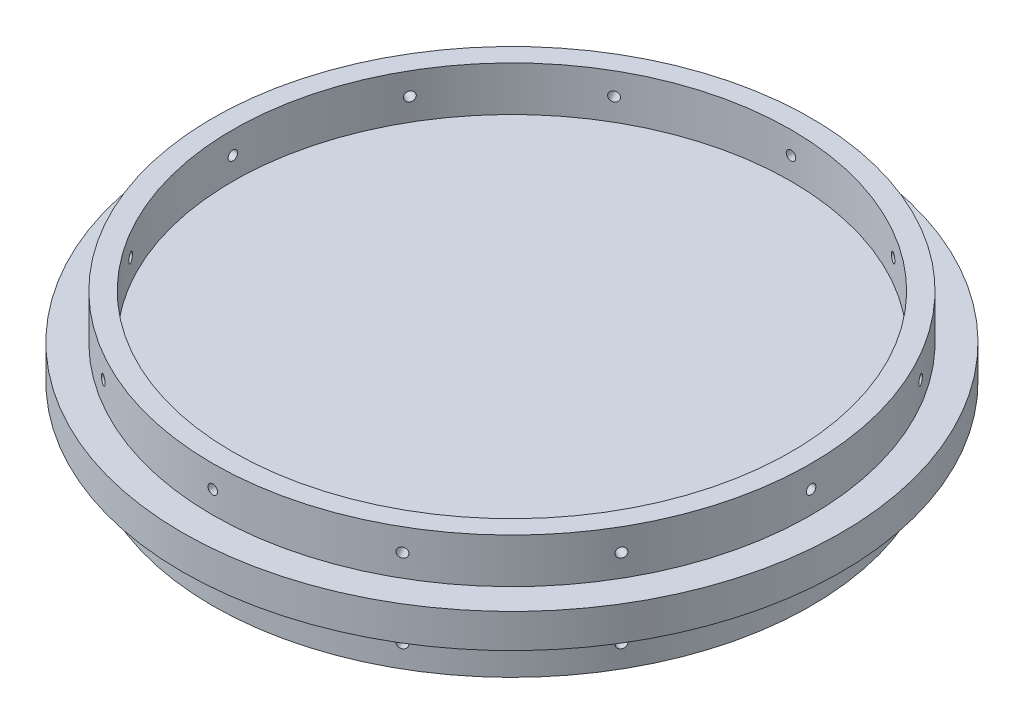
from build123d import *

# Parameters (mm, degrees)
SKETCH1_R                = 93.726
BOSS_EXTRUDE1_DEPTH      = 4.826
SKETCH4_R                = 85.09
SKETCH4_R_2              = 79.375
BOSS_EXTRUDE2_DEPTH      = 12.7
SKETCH5_R                = 1.35255
CUT_EXTRUDE2_DEPTH       = 12.7
CIRPATTERN1_COUNT        = 12
MIRROR2_COPY_1_SKETCH_R  = 1.35255
MIRROR2_COPY_1_DEPTH     = 12.7
MIRROR2_COPY_2_SKETCH_R  = 1.35255
MIRROR2_COPY_2_DEPTH     = 12.7
MIRROR2_COPY_3_SKETCH_R  = 1.35255
MIRROR2_COPY_3_DEPTH     = 12.7
MIRROR2_COPY_4_SKETCH_R  = 1.35255
MIRROR2_COPY_4_DEPTH     = 12.7
MIRROR2_COPY_5_SKETCH_R  = 1.35255
MIRROR2_COPY_5_DEPTH     = 12.7
MIRROR2_COPY_6_SKETCH_R  = 1.35255
MIRROR2_COPY_6_DEPTH     = 12.7
MIRROR2_COPY_7_SKETCH_R  = 1.35255
MIRROR2_COPY_7_DEPTH     = 12.7
MIRROR2_COPY_8_SKETCH_R  = 1.35255
MIRROR2_COPY_8_DEPTH     = 12.7
MIRROR2_COPY_9_SKETCH_R  = 1.35255
MIRROR2_COPY_9_DEPTH     = 12.7
MIRROR2_COPY_10_SKETCH_R = 1.35255
MIRROR2_COPY_10_DEPTH    = 12.7
MIRROR2_COPY_11_SKETCH_R = 1.35255
MIRROR2_COPY_11_DEPTH    = 12.7


with BuildPart() as part:
    # Sketch1 → Boss-Extrude1 (new, symmetric)
    with BuildSketch(Plane(origin=(0, 0, 0), x_dir=(1, 0, 0), z_dir=(0, 1, 0))):
        Circle(SKETCH1_R)
    extrude(amount=BOSS_EXTRUDE1_DEPTH, both=True)

    # Sketch2 → Cut-Revolve1 (revolve, cut)
    with BuildSketch(Plane.XY):
        with BuildLine():
            Line((0, -4.826), (-25.4, -4.826))
            add(Edge.make_bspline(
                [(0, 1.27), (-5.119708802, 1.512901127), (-13.685198777, -0.496611023), (-22.158477128, -2.939757283), (-25.4, -4.826)],
                knots=[0, 0, 0, 0, 0.575798634, 1, 1, 1, 1], degree=3))
            Line((0, 1.27), (0, -4.826))
        make_face()
    revolve(axis=Axis((0, -18.327530441, 0), (0, 1, 0)), mode=Mode.SUBTRACT)

    # Sketch4 → Boss-Extrude2 (add)
    with BuildSketch(Plane(origin=(0, 4.826, 0), x_dir=(1, 0, 0), z_dir=(0, 1, 0))):
        Circle(SKETCH4_R)
        Circle(SKETCH4_R_2, mode=Mode.SUBTRACT)
    boss_extrude2 = extrude(amount=BOSS_EXTRUDE2_DEPTH)

    # Sketch5 → Cut-Extrude2 (cut)
    with BuildSketch(Plane(origin=(0, 0, -85.09), x_dir=(-1, 0, 0), z_dir=(0, 0, -1))):
        with Locations((0, 11.176)):
            Circle(SKETCH5_R)
    cut_extrude2 = extrude(amount=-CUT_EXTRUDE2_DEPTH, mode=Mode.SUBTRACT)

    # CirPattern1: Cut-Extrude2 ×12 about axis
    cirpattern1_axis = Axis((0, 17.526, 0), (0, -1, 0))
    for i in range(1, CIRPATTERN1_COUNT):
        add(cut_extrude2.rotate(cirpattern1_axis, i * 360 / CIRPATTERN1_COUNT), mode=Mode.SUBTRACT)

    # Mirror2: Boss-Extrude2, Cut-Extrude2 across plane
    add(boss_extrude2.mirror(Plane.ZX))
    add(cut_extrude2.mirror(Plane.ZX), mode=Mode.SUBTRACT)

    # Mirror2 copy 1 sketch → Mirror2 copy 1 (cut)
    with BuildSketch(Plane(origin=(42.545, 0, -73.690101608), x_dir=(-0.8660254037844387, 0, -0.49999999999999994), z_dir=(0.49999999999999994, 0, -0.8660254037844387))):
        with Locations((0, -11.176)):
            Circle(MIRROR2_COPY_1_SKETCH_R)
    extrude(amount=-MIRROR2_COPY_1_DEPTH, mode=Mode.SUBTRACT)

    # Mirror2 copy 2 sketch → Mirror2 copy 2 (cut)
    with BuildSketch(Plane(origin=(73.690101608, 0, -42.545), x_dir=(-0.5000000000000001, 0, -0.8660254037844386), z_dir=(0.8660254037844386, 0, -0.5000000000000001))):
        with Locations((0, -11.176)):
            Circle(MIRROR2_COPY_2_SKETCH_R)
    extrude(amount=-MIRROR2_COPY_2_DEPTH, mode=Mode.SUBTRACT)

    # Mirror2 copy 3 sketch → Mirror2 copy 3 (cut)
    with BuildSketch(Plane(origin=(85.09, 0, 0), x_dir=(0, 0, -1), z_dir=(1, 0, 0))):
        with Locations((0, -11.176)):
            Circle(MIRROR2_COPY_3_SKETCH_R)
    extrude(amount=-MIRROR2_COPY_3_DEPTH, mode=Mode.SUBTRACT)

    # Mirror2 copy 4 sketch → Mirror2 copy 4 (cut)
    with BuildSketch(Plane(origin=(73.690101608, 0, 42.545), x_dir=(0.4999999999999998, 0, -0.8660254037844387), z_dir=(0.8660254037844387, 0, 0.4999999999999998))):
        with Locations((0, -11.176)):
            Circle(MIRROR2_COPY_4_SKETCH_R)
    extrude(amount=-MIRROR2_COPY_4_DEPTH, mode=Mode.SUBTRACT)

    # Mirror2 copy 5 sketch → Mirror2 copy 5 (cut)
    with BuildSketch(Plane(origin=(42.545, 0, 73.690101608), x_dir=(0.8660254037844387, 0, -0.49999999999999994), z_dir=(0.49999999999999994, 0, 0.8660254037844387))):
        with Locations((0, -11.176)):
            Circle(MIRROR2_COPY_5_SKETCH_R)
    extrude(amount=-MIRROR2_COPY_5_DEPTH, mode=Mode.SUBTRACT)

    # Mirror2 copy 6 sketch → Mirror2 copy 6 (cut)
    with BuildSketch(Plane.XY.offset(85.09)):
        with Locations((0, -11.176)):
            Circle(MIRROR2_COPY_6_SKETCH_R)
    extrude(amount=-MIRROR2_COPY_6_DEPTH, mode=Mode.SUBTRACT)

    # Mirror2 copy 7 sketch → Mirror2 copy 7 (cut)
    with BuildSketch(Plane(origin=(-42.545, 0, 73.690101608), x_dir=(0.8660254037844386, 0, 0.5000000000000001), z_dir=(-0.5000000000000001, 0, 0.8660254037844386))):
        with Locations((0, -11.176)):
            Circle(MIRROR2_COPY_7_SKETCH_R)
    extrude(amount=-MIRROR2_COPY_7_DEPTH, mode=Mode.SUBTRACT)

    # Mirror2 copy 8 sketch → Mirror2 copy 8 (cut)
    with BuildSketch(Plane(origin=(-73.690101608, 0, 42.545), x_dir=(0.5000000000000004, 0, 0.8660254037844384), z_dir=(-0.8660254037844384, 0, 0.5000000000000004))):
        with Locations((0, -11.176)):
            Circle(MIRROR2_COPY_8_SKETCH_R)
    extrude(amount=-MIRROR2_COPY_8_DEPTH, mode=Mode.SUBTRACT)

    # Mirror2 copy 9 sketch → Mirror2 copy 9 (cut)
    with BuildSketch(Plane.ZY.offset(85.09)):
        with Locations((0, -11.176)):
            Circle(MIRROR2_COPY_9_SKETCH_R)
    extrude(amount=-MIRROR2_COPY_9_DEPTH, mode=Mode.SUBTRACT)

    # Mirror2 copy 10 sketch → Mirror2 copy 10 (cut)
    with BuildSketch(Plane(origin=(-73.690101608, 0, -42.545), x_dir=(-0.5000000000000001, 0, 0.8660254037844386), z_dir=(-0.8660254037844386, 0, -0.5000000000000001))):
        with Locations((0, -11.176)):
            Circle(MIRROR2_COPY_10_SKETCH_R)
    extrude(amount=-MIRROR2_COPY_10_DEPTH, mode=Mode.SUBTRACT)

    # Mirror2 copy 11 sketch → Mirror2 copy 11 (cut)
    with BuildSketch(Plane(origin=(-42.545, 0, -73.690101608), x_dir=(-0.8660254037844384, 0, 0.5000000000000004), z_dir=(-0.5000000000000004, 0, -0.8660254037844384))):
        with Locations((0, -11.176)):
            Circle(MIRROR2_COPY_11_SKETCH_R)
    extrude(amount=-MIRROR2_COPY_11_DEPTH, mode=Mode.SUBTRACT)


solid = part.part
